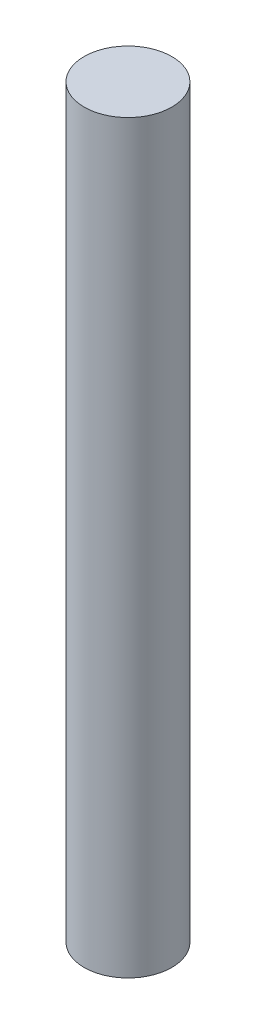
from build123d import *

# Parameters (mm, degrees)
SKETCH1_R           = 2
BOSS_EXTRUDE1_DEPTH = 17


with BuildPart() as part:
    # Sketch1 → Boss-Extrude1 (new, symmetric)
    with BuildSketch(Plane(origin=(0, 0, 0), x_dir=(1, 0, 0), z_dir=(0, 1, 0))):
        Circle(SKETCH1_R)
    extrude(amount=BOSS_EXTRUDE1_DEPTH, both=True)


solid = part.part
